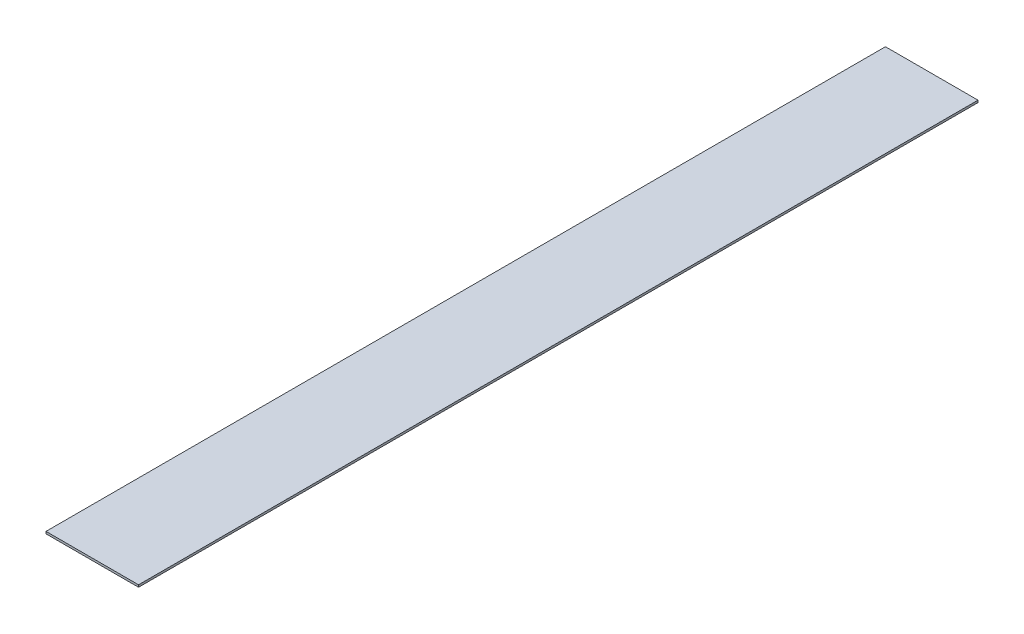
from build123d import *

# Parameters (mm, degrees)
SKETCH2_W           = 4.3
SKETCH2_H           = 39
BOSS_EXTRUDE1_DEPTH = 0.05


with BuildPart() as part:
    # Sketch2 → Boss-Extrude1 (new, symmetric)
    with BuildSketch(Plane(origin=(0, 0, 0), x_dir=(1, 0, 0), z_dir=(0, 1, 0))):
        Rectangle(SKETCH2_W, SKETCH2_H)
    extrude(amount=BOSS_EXTRUDE1_DEPTH, both=True)


solid = part.part
